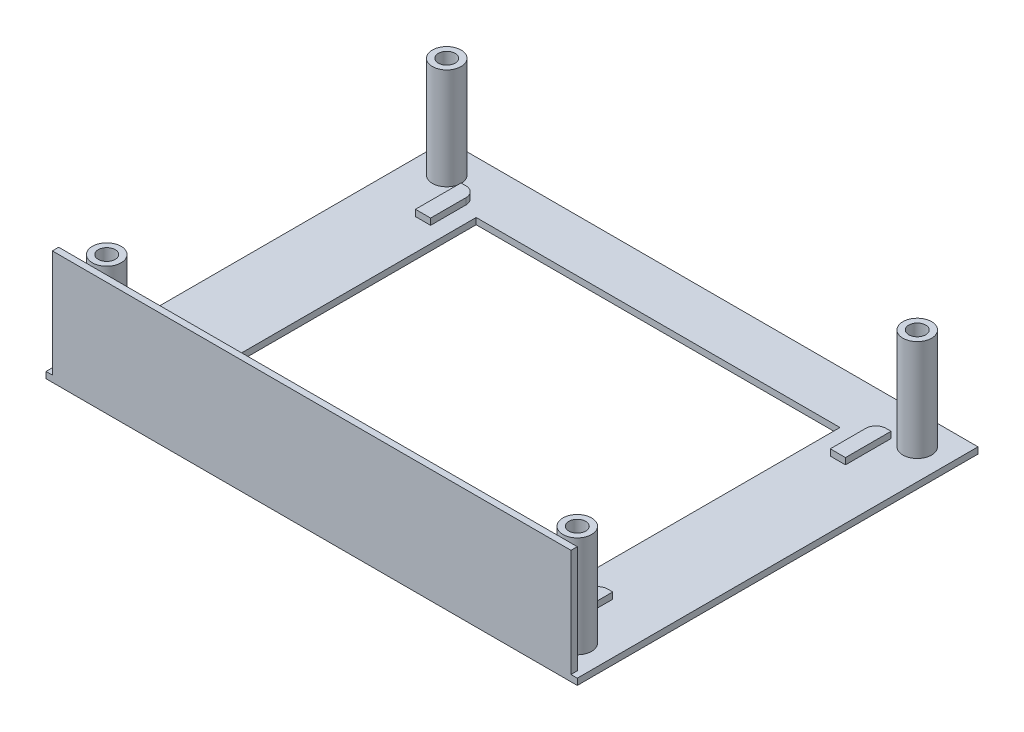
from build123d import *

# Parameters (mm, degrees)
SKETCH1_W           = 133.30125
SKETCH1_H           = 100.542495842
BOSS_EXTRUDE1_DEPTH = 1.5875
SKETCH1_3_R         = 3.6
SKETCH1_3_R_2       = 2.125
BOSS_EXTRUDE2_DEPTH = 25.4
BOSS_EXTRUDE4_DEPTH = 1.5875
SKETCH1_7_W         = 91.28125
SKETCH1_7_H         = 68.2625
CUT_EXTRUDE1_DEPTH  = 4.1275
SKETCH1_9_W         = 130.12625
SKETCH1_9_H         = 1.5875
BOSS_EXTRUDE5_DEPTH = 26.9875


with BuildPart() as part:
    # Sketch1 → Boss-Extrude1 (new body)
    with BuildSketch(Plane(origin=(0, 0, 0), x_dir=(1, 0, 0), z_dir=(0, 1, 0))):
        with Locations((0.5, -3.020002079)):
            Rectangle(SKETCH1_W, SKETCH1_H)
    extrude(amount=-BOSS_EXTRUDE1_DEPTH)

    # Sketch1<3> → Boss-Extrude2 (add)
    # profile 1 of 4: a face of its own
    with BuildSketch(Plane(origin=(0, 0, 0), x_dir=(1, 0, 0), z_dir=(0, 1, 0))):
        with Locations((59.530625, 39.631245842)):
            Circle(SKETCH1_3_R)
        with Locations((59.530625, 39.631245842)):
            Circle(SKETCH1_3_R_2, mode=Mode.SUBTRACT)
    # profile 2 of 4: a face of its own
    with BuildSketch(Plane(origin=(0, 0, 0), x_dir=(1, 0, 0), z_dir=(0, 1, 0))):
        with Locations((-58.530625, 39.631245842)):
            Circle(SKETCH1_3_R)
        with Locations((-58.530625, 39.631245842)):
            Circle(SKETCH1_3_R_2, mode=Mode.SUBTRACT)
    # profile 3 of 4: a face of its own
    with BuildSketch(Plane(origin=(0, 0, 0), x_dir=(1, 0, 0), z_dir=(0, 1, 0))):
        with Locations((59.530625, -45.67125)):
            Circle(SKETCH1_3_R)
        with Locations((59.530625, -45.67125)):
            Circle(SKETCH1_3_R_2, mode=Mode.SUBTRACT)
    # profile 4 of 4: a face of its own
    with BuildSketch(Plane(origin=(0, 0, 0), x_dir=(1, 0, 0), z_dir=(0, 1, 0))):
        with Locations((-58.530625, -45.67125)):
            Circle(SKETCH1_3_R)
        with Locations((-58.530625, -45.67125)):
            Circle(SKETCH1_3_R_2, mode=Mode.SUBTRACT)
    extrude(amount=BOSS_EXTRUDE2_DEPTH)

    # Sketch1<6> → Boss-Extrude4 (add)
    with BuildSketch(Plane(origin=(0, 0, 0), x_dir=(1, 0, 0), z_dir=(0, 1, 0))):
        with BuildLine():
            ThreePointArc((53.180625, 38.13125), (51.384573776, 37.387301224), (50.640625, 35.59125))
            Line((50.640625, 35.59125), (50.640625, 26.70125))
            Line((50.640625, 26.70125), (54.450625, 26.70125))
            Line((54.450625, 26.70125), (54.450625, 38.13125))
            Line((54.450625, 38.13125), (53.180625, 38.13125))
        make_face()
        with BuildLine():
            Line((50.640625, -43.13125), (39.210625, -43.13125))
            Line((39.210625, -43.13125), (39.210625, -46.94125))
            Line((39.210625, -46.94125), (54.450625, -46.94125))
            Line((54.450625, -46.94125), (54.450625, -31.70125))
            Line((54.450625, -31.70125), (53.180625, -31.70125))
            ThreePointArc((53.180625, -31.70125), (51.384573776, -32.445198776), (50.640625, -34.24125))
            Line((50.640625, -34.24125), (50.640625, -43.13125))
        make_face()
        with BuildLine():
            Line((-49.640625, -43.13125), (-49.640625, -34.24125))
            ThreePointArc((-49.640625, -34.24125), (-50.384573776, -32.445198776), (-52.180625, -31.70125))
            Line((-52.180625, -31.70125), (-53.450625, -31.70125))
            Line((-53.450625, -31.70125), (-53.450625, -46.94125))
            Line((-53.450625, -46.94125), (-36.940625, -46.94125))
            Line((-36.940625, -46.94125), (-36.940625, -43.13125))
            Line((-36.940625, -43.13125), (-49.640625, -43.13125))
        make_face()
        with BuildLine():
            Line((-49.640625, 26.70125), (-49.640625, 35.59125))
            ThreePointArc((-49.640625, 35.59125), (-50.384573776, 37.387301224), (-52.180625, 38.13125))
            Line((-52.180625, 38.13125), (-53.450625, 38.13125))
            Line((-53.450625, 38.13125), (-53.450625, 26.70125))
            Line((-53.450625, 26.70125), (-49.640625, 26.70125))
        make_face()
    extrude(amount=BOSS_EXTRUDE4_DEPTH)

    # Sketch1<7> → Cut-Extrude1 (cut)
    with BuildSketch(Plane(origin=(0, 0, 0), x_dir=(1, 0, 0), z_dir=(0, 1, 0))):
        Rectangle(SKETCH1_7_W, SKETCH1_7_H)
    extrude(amount=-CUT_EXTRUDE1_DEPTH, mode=Mode.SUBTRACT)

    # Sketch1<9> → Boss-Extrude5 (add)
    with BuildSketch(Plane(origin=(0, 0, 0), x_dir=(1, 0, 0), z_dir=(0, 1, 0))):
        with Locations((0.5, -52.4975)):
            Rectangle(SKETCH1_9_W, SKETCH1_9_H)
    extrude(amount=BOSS_EXTRUDE5_DEPTH)


solid = part.part
